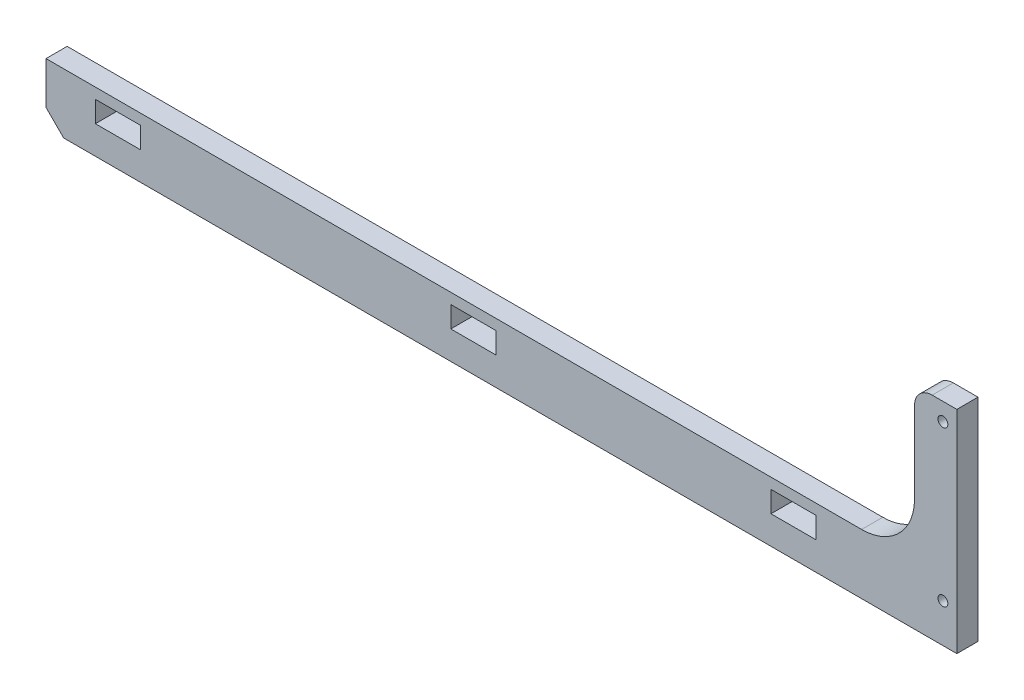
from build123d import *

# Parameters (mm, degrees)
SKETCH_1_R      = 1.4
SKETCH_1_W      = 12.8
SKETCH_1_H      = 6
EXTRUDE_1_DEPTH = 6


with BuildPart() as part:
    # Эскиз1 → Бобышка-Вытянуть1 (new body)
    with BuildSketch(Plane.XY):
        with BuildLine():
            Line((-167.182566644, 6), (64.127433356, 6))
            ThreePointArc((64.127433356, 6), (74.734035074, 10.393398282), (79.127433356, 21))
            Line((79.127433356, 21), (79.127433356, 44))
            ThreePointArc((79.127433356, 44), (80.59189945, 47.535533906), (84.127433356, 49))
            Line((84.127433356, 49), (91.127433356, 49))
            Line((91.127433356, 49), (91.127433356, 6))
            Line((91.127433356, 6), (91.127433356, -11))
            Line((91.127433356, -11), (-162.182566644, -11))
            Line((-162.182566644, -11), (-167.182566644, -6))
            Line((-167.182566644, -6), (-167.182566644, 6))
        make_face()
        with Locations((87.177433356, 0)):
            Circle(SKETCH_1_R, mode=Mode.SUBTRACT)
        with Locations((87.177433356, 44)):
            Circle(SKETCH_1_R, mode=Mode.SUBTRACT)
        with Locations((44.817433356, 0)):
            Rectangle(SKETCH_1_W, SKETCH_1_H, mode=Mode.SUBTRACT)
        with Locations((-45.982566644, 0)):
            Rectangle(SKETCH_1_W, SKETCH_1_H, mode=Mode.SUBTRACT)
        with Locations((-146.782566644, 0)):
            Rectangle(SKETCH_1_W, SKETCH_1_H, mode=Mode.SUBTRACT)
    extrude(amount=EXTRUDE_1_DEPTH)


solid = part.part
